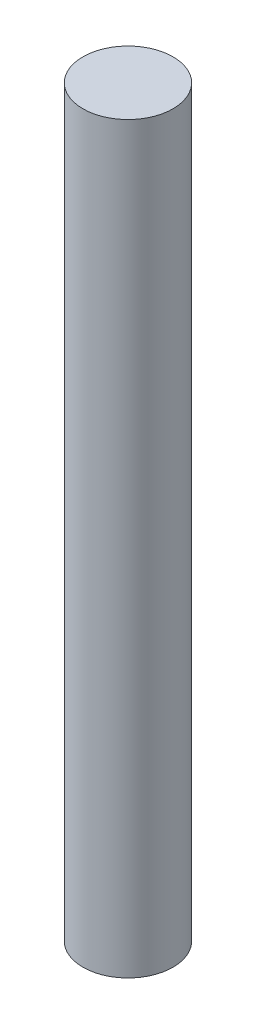
from build123d import *

# Parameters (mm, degrees)
SKETCH_1_R      = 4
EXTRUDE_1_DEPTH = 66


with BuildPart() as part:
    # Эскиз1 → Бобышка-Вытянуть1 (new body)
    with BuildSketch(Plane(origin=(0, 0, 0), x_dir=(1, 0, 0), z_dir=(0, 1, 0))):
        Circle(SKETCH_1_R)
    extrude(amount=EXTRUDE_1_DEPTH)


solid = part.part
